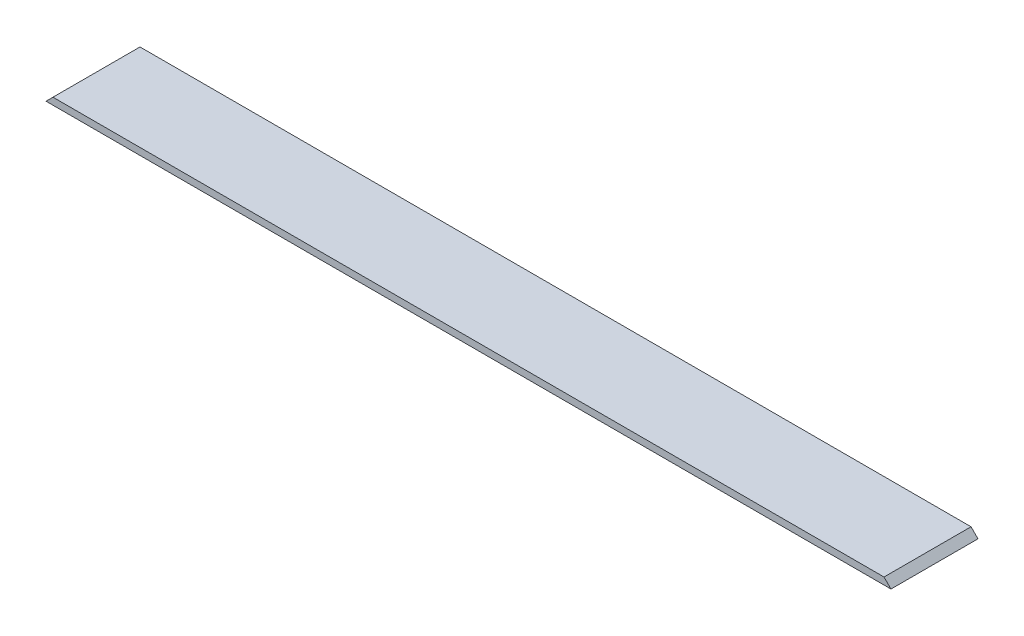
from build123d import *

# Parameters (mm, degrees)
BOSS_EXTRUDE1_DEPTH = 63.5


with BuildPart() as part:
    # Sketch1 → Boss-Extrude1 (new body)
    with BuildSketch(Plane.XY):
        Polygon((-279.760461327, 0), (336.824538673, 0), (331.744538673, 5.08), (-274.680461327, 5.08), align=None)
    extrude(amount=BOSS_EXTRUDE1_DEPTH)


solid = part.part
